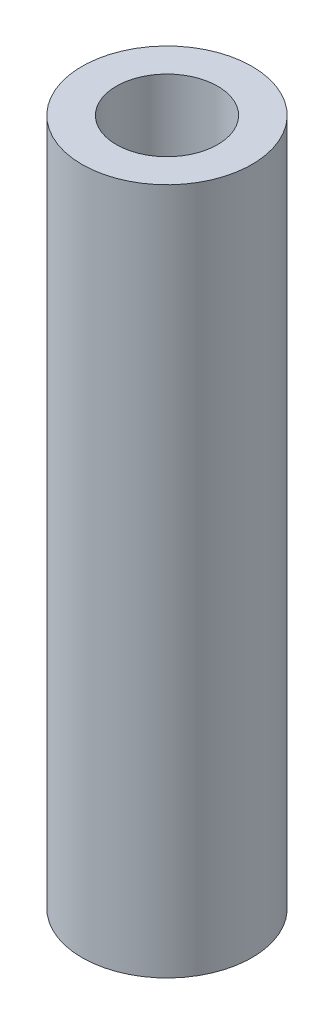
from build123d import *

# Parameters (mm, degrees)
SKETCH1_R           = 2.475
SKETCH1_R_2         = 1.475
BOSS_EXTRUDE1_DEPTH = 20


with BuildPart() as part:
    # Sketch1 → Boss-Extrude1 (new body)
    with BuildSketch(Plane(origin=(0, 0, 0), x_dir=(1, 0, 0), z_dir=(0, 1, 0))):
        Circle(SKETCH1_R)
        Circle(SKETCH1_R_2, mode=Mode.SUBTRACT)
    extrude(amount=BOSS_EXTRUDE1_DEPTH)


solid = part.part
